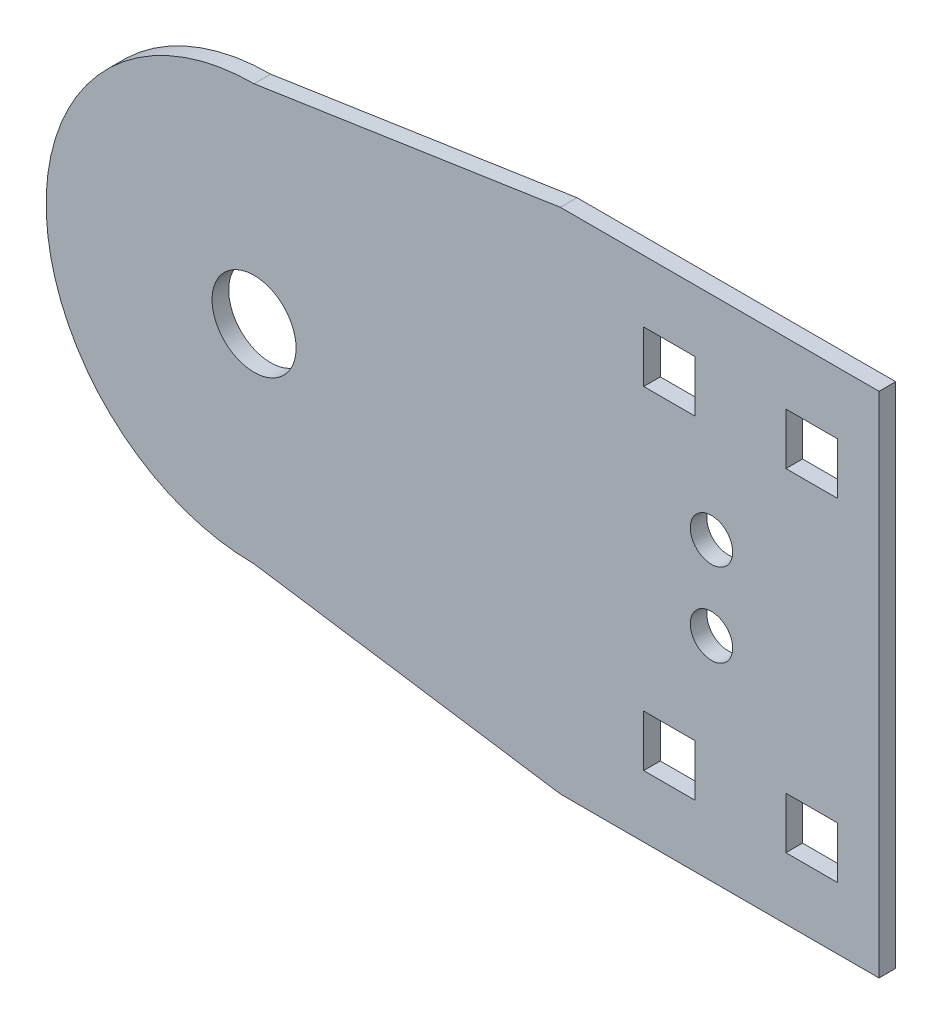
from build123d import *

# Parameters (mm, degrees)
SKETCH_1_R      = 5.05
SKETCH_1_R_2    = 2.55
SKETCH_1_W      = 6.2
SKETCH_1_H      = 6.2
EXTRUDE_1_DEPTH = 2


with BuildPart() as part:
    # 草图1 → 凸台-拉伸1 (new body)
    with BuildSketch(Plane.XY):
        with BuildLine():
            Line((0, -25), (36.822908512, -30.548036369))
            Line((36.822908512, -30.548036369), (75.15, -30.548036369))
            Line((75.15, -30.548036369), (75.15, 30.548036369))
            Line((75.15, 30.548036369), (36.822908512, 30.548036369))
            Line((36.822908512, 30.548036369), (0, 25))
            ThreePointArc((0, 25), (-25, 0), (0, -25))
        make_face()
        Circle(SKETCH_1_R, mode=Mode.SUBTRACT)
        with Locations((55, 5)):
            Circle(SKETCH_1_R_2, mode=Mode.SUBTRACT)
        with Locations((55, -5)):
            Circle(SKETCH_1_R_2, mode=Mode.SUBTRACT)
        with Locations((67.05, -20)):
            Rectangle(SKETCH_1_W, SKETCH_1_H, mode=Mode.SUBTRACT)
        with Locations((49.95, -20)):
            Rectangle(SKETCH_1_W, SKETCH_1_H, mode=Mode.SUBTRACT)
        with Locations((49.95, 20)):
            Rectangle(SKETCH_1_W, SKETCH_1_H, mode=Mode.SUBTRACT)
        with Locations((67.05, 20)):
            Rectangle(SKETCH_1_W, SKETCH_1_H, mode=Mode.SUBTRACT)
    extrude(amount=EXTRUDE_1_DEPTH)


solid = part.part
